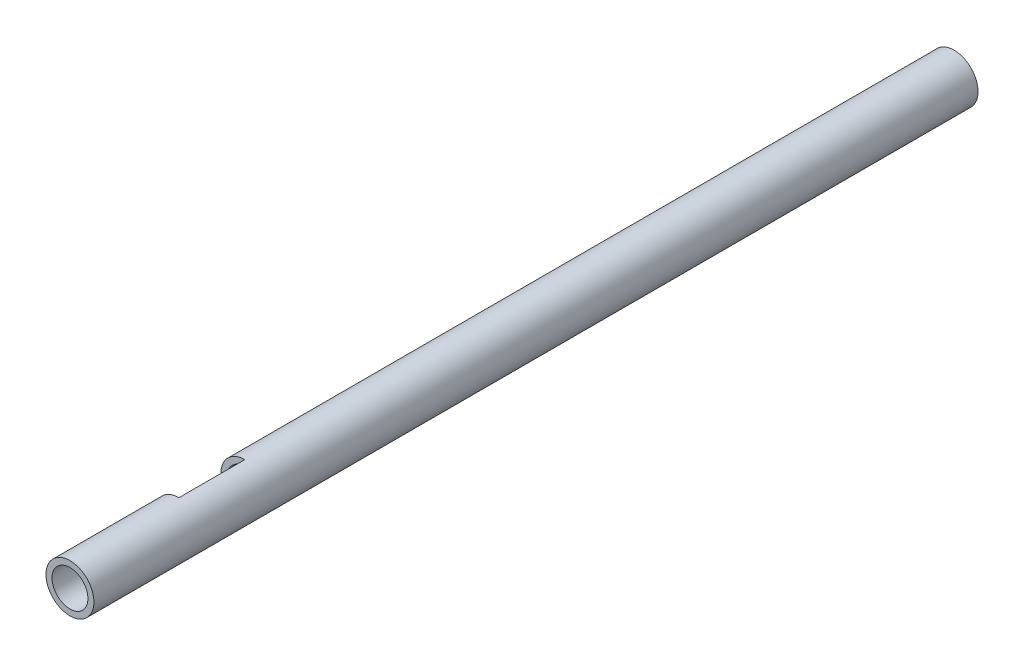
from build123d import *

# Parameters (mm, degrees)
SKETCH1_W               = 738
SKETCH1_H               = 5
CUT_EXTRUDE1_DEPTH      = 739.541806535
CUT_EXTRUDE1_DEPTH_BACK = 739.541806535
SKETCH2_W               = 37.714751534
SKETCH2_H               = 55


with BuildPart() as part:
    # Sketch1 → Revolve1 (revolve)
    with BuildSketch(Plane(origin=(0, 0, 0), x_dir=(0, 0, -1), z_dir=(1, 0, 0))):
        with Locations((-369, 17.5)):
            Rectangle(SKETCH1_W, SKETCH1_H)
    revolve(axis=Axis((0, 0, 0), (0, 0, 1)))

    # Sketch2 → Cut-Extrude1 (cut, two sides: drawn at the far end of the back side and taken through both)
    with BuildSketch(Plane(origin=(0, 0, 0), x_dir=(1, 0, 0), z_dir=(0, 1, 0)).offset(-CUT_EXTRUDE1_DEPTH_BACK)):
        with Locations((-18.857375767, -619.5)):
            Rectangle(SKETCH2_W, SKETCH2_H)
    extrude(amount=CUT_EXTRUDE1_DEPTH + CUT_EXTRUDE1_DEPTH_BACK, mode=Mode.SUBTRACT)


solid = part.part
